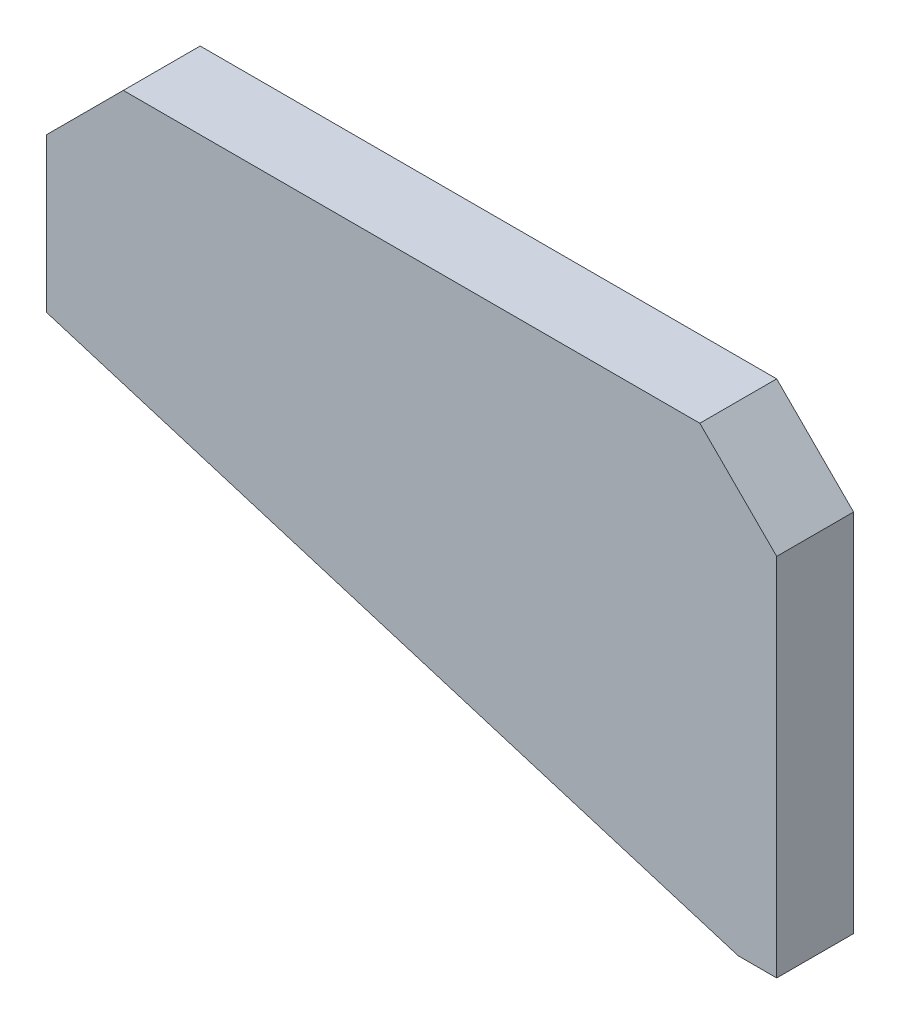
from build123d import *

# Parameters (mm, degrees)
SM_START               = -5
SM_BASE_FLANGE_1_DEPTH = 10
CHAMFER_1_SIZE         = 10


# Read off the part's stored shape, not the designer's step: Базовая кромка1
with BuildPart() as part:
    # Базовая кромка1 outline → Базовая кромка1 (new body)
    with BuildSketch(Plane.XY.offset(SM_START)):
        Polygon((0, 0), (-95, 0), (-95, -30), (-5, -57.5), (0, -57.5), align=None)
    extrude(amount=SM_BASE_FLANGE_1_DEPTH)

    # Фаска1
    chamfer_1_edges = [part.edges().sort_by_distance(p)[0] for p in [
        (-95, 0, 0),
        (0, 0, 0),
    ]]
    chamfer(chamfer_1_edges, length=CHAMFER_1_SIZE)


solid = part.part
